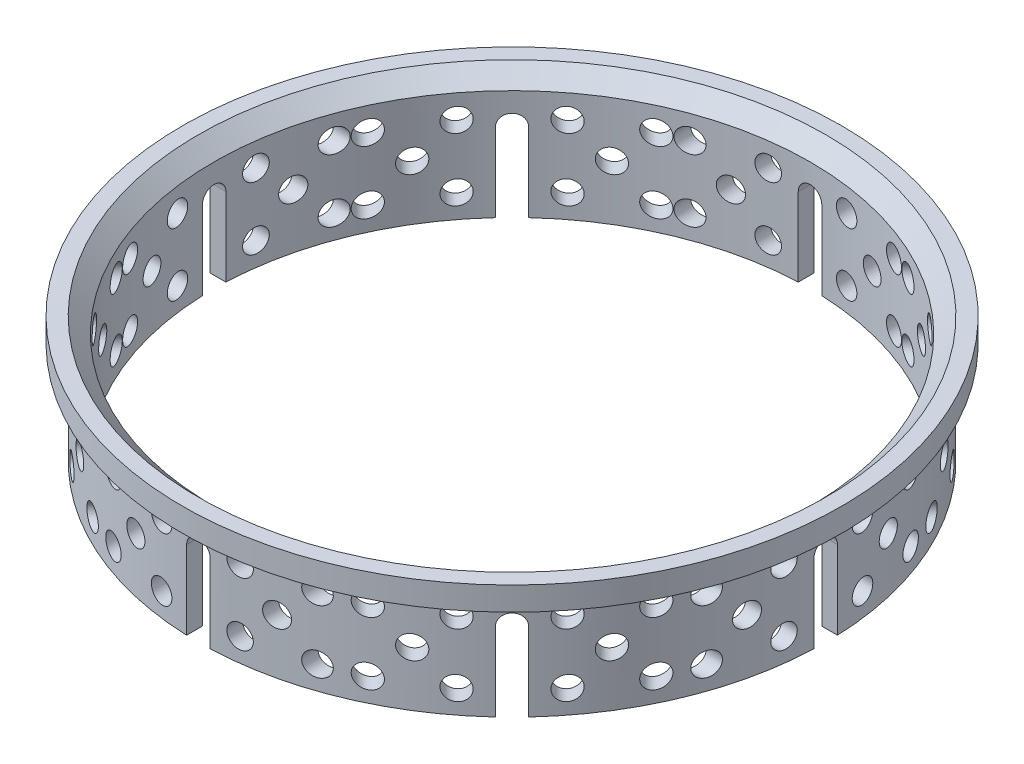
from build123d import *

# Parameters (mm, degrees)
CUT_EXTRUDE2_REACH      = 120.757
CUT_EXTRUDE2_END_RADIUS = 48.26
SKETCH5_R               = 1.905
CIRPATTERN1_COUNT       = 8


with BuildPart() as part:
    # Sketch2 → Revolve1 (revolve)
    with BuildSketch(Plane.XY):
        Polygon((53.34, 20.32), (53.34, 16.51), (50.8, 16.51), (50.8, 0), (48.26, 0), (48.26, 17.78), (50.8, 20.32), align=None)
    revolve(axis=Axis((0, 0, 0), (0, 1, 0)))

    # Cut-Extrude2: up to this cylinder (the profile starts outside it)
    cut_extrude2_end = Plane(origin=(0, 8.89, 0), z_dir=(0, -1, 0)) * Cylinder(CUT_EXTRUDE2_END_RADIUS, 349.194, mode=Mode.PRIVATE)
    # Sketch5 → Cut-Extrude2 (cut, up to the surface)
    with BuildSketch(Plane.XY.offset(50.8), mode=Mode.PRIVATE) as cut_extrude2_sk1:
        with Locations((-16.51, 13.97)):
            Circle(SKETCH5_R)
    cut_extrude2_tool1 = extrude(cut_extrude2_sk1.sketch, amount=-CUT_EXTRUDE2_REACH, mode=Mode.PRIVATE) - cut_extrude2_end
    # Sketch5 → Cut-Extrude2 (cut, up to the surface)
    with BuildSketch(Plane.XY.offset(50.8), mode=Mode.PRIVATE) as cut_extrude2_sk2:
        with Locations((-6.35, 13.97)):
            Circle(SKETCH5_R)
    cut_extrude2_tool2 = extrude(cut_extrude2_sk2.sketch, amount=-CUT_EXTRUDE2_REACH, mode=Mode.PRIVATE) - cut_extrude2_end
    # Sketch5 → Cut-Extrude2 (cut, up to the surface)
    with BuildSketch(Plane.XY.offset(50.8), mode=Mode.PRIVATE) as cut_extrude2_sk3:
        with Locations((-11.43, 8.89)):
            Circle(SKETCH5_R)
    cut_extrude2_tool3 = extrude(cut_extrude2_sk3.sketch, amount=-CUT_EXTRUDE2_REACH, mode=Mode.PRIVATE) - cut_extrude2_end
    # Sketch5 → Cut-Extrude2 (cut, up to the surface)
    with BuildSketch(Plane.XY.offset(50.8), mode=Mode.PRIVATE) as cut_extrude2_sk4:
        with Locations((-16.51, 3.81)):
            Circle(SKETCH5_R)
    cut_extrude2_tool4 = extrude(cut_extrude2_sk4.sketch, amount=-CUT_EXTRUDE2_REACH, mode=Mode.PRIVATE) - cut_extrude2_end
    # Sketch5 → Cut-Extrude2 (cut, up to the surface)
    with BuildSketch(Plane.XY.offset(50.8), mode=Mode.PRIVATE) as cut_extrude2_sk5:
        with Locations((-6.35, 3.81)):
            Circle(SKETCH5_R)
    cut_extrude2_tool5 = extrude(cut_extrude2_sk5.sketch, amount=-CUT_EXTRUDE2_REACH, mode=Mode.PRIVATE) - cut_extrude2_end
    # Sketch5 → Cut-Extrude2 (cut, up to the surface)
    with BuildSketch(Plane.XY.offset(50.8), mode=Mode.PRIVATE) as cut_extrude2_sk6:
        with Locations((16.51, 3.81)):
            Circle(SKETCH5_R)
    cut_extrude2_tool6 = extrude(cut_extrude2_sk6.sketch, amount=-CUT_EXTRUDE2_REACH, mode=Mode.PRIVATE) - cut_extrude2_end
    # Sketch5 → Cut-Extrude2 (cut, up to the surface)
    with BuildSketch(Plane.XY.offset(50.8), mode=Mode.PRIVATE) as cut_extrude2_sk7:
        with Locations((6.35, 3.81)):
            Circle(SKETCH5_R)
    cut_extrude2_tool7 = extrude(cut_extrude2_sk7.sketch, amount=-CUT_EXTRUDE2_REACH, mode=Mode.PRIVATE) - cut_extrude2_end
    # Sketch5 → Cut-Extrude2 (cut, up to the surface)
    with BuildSketch(Plane.XY.offset(50.8), mode=Mode.PRIVATE) as cut_extrude2_sk8:
        with Locations((11.43, 8.89)):
            Circle(SKETCH5_R)
    cut_extrude2_tool8 = extrude(cut_extrude2_sk8.sketch, amount=-CUT_EXTRUDE2_REACH, mode=Mode.PRIVATE) - cut_extrude2_end
    # Sketch5 → Cut-Extrude2 (cut, up to the surface)
    with BuildSketch(Plane.XY.offset(50.8), mode=Mode.PRIVATE) as cut_extrude2_sk9:
        with Locations((6.35, 13.97)):
            Circle(SKETCH5_R)
    cut_extrude2_tool9 = extrude(cut_extrude2_sk9.sketch, amount=-CUT_EXTRUDE2_REACH, mode=Mode.PRIVATE) - cut_extrude2_end
    # Sketch5 → Cut-Extrude2 (cut, up to the surface)
    with BuildSketch(Plane.XY.offset(50.8), mode=Mode.PRIVATE) as cut_extrude2_sk10:
        with Locations((16.51, 13.97)):
            Circle(SKETCH5_R)
    cut_extrude2_tool10 = extrude(cut_extrude2_sk10.sketch, amount=-CUT_EXTRUDE2_REACH, mode=Mode.PRIVATE) - cut_extrude2_end
    # Sketch5 → Cut-Extrude2 (cut, up to the surface)
    with BuildSketch(Plane.XY.offset(50.8), mode=Mode.PRIVATE) as cut_extrude2_sk11:
        with BuildLine():
            Line((-1.905, 0), (1.905, 0))
            Line((1.905, 0), (1.905, 12.7))
            ThreePointArc((1.905, 12.7), (0, 14.605), (-1.905, 12.7))
            Line((-1.905, 12.7), (-1.905, 0))
        make_face()
    cut_extrude2_tool11 = extrude(cut_extrude2_sk11.sketch, amount=-CUT_EXTRUDE2_REACH, mode=Mode.PRIVATE) - cut_extrude2_end
    cut_extrude2 = cut_extrude2_tool1.solids().sort_by_distance((-16.51, 13.97, 50.8))[0] + cut_extrude2_tool2.solids().sort_by_distance((-6.35, 13.97, 50.8))[0] + cut_extrude2_tool3.solids().sort_by_distance((-11.43, 8.89, 50.8))[0] + cut_extrude2_tool4.solids().sort_by_distance((-16.51, 3.81, 50.8))[0] + cut_extrude2_tool5.solids().sort_by_distance((-6.35, 3.81, 50.8))[0] + cut_extrude2_tool6.solids().sort_by_distance((16.51, 3.81, 50.8))[0] + cut_extrude2_tool7.solids().sort_by_distance((6.35, 3.81, 50.8))[0] + cut_extrude2_tool8.solids().sort_by_distance((11.43, 8.89, 50.8))[0] + cut_extrude2_tool9.solids().sort_by_distance((6.35, 13.97, 50.8))[0] + cut_extrude2_tool10.solids().sort_by_distance((16.51, 13.97, 50.8))[0] + cut_extrude2_tool11.solids().sort_by_distance((0, 7.104459, 50.8))[0]
    add(cut_extrude2, mode=Mode.SUBTRACT)

    # CirPattern1: Cut-Extrude2 ×8 about axis
    cirpattern1_axis = Axis((0, 0, 0), (0, -1, 0))
    for i in range(1, CIRPATTERN1_COUNT):
        add(cut_extrude2.rotate(cirpattern1_axis, i * 360 / CIRPATTERN1_COUNT), mode=Mode.SUBTRACT)


solid = part.part
